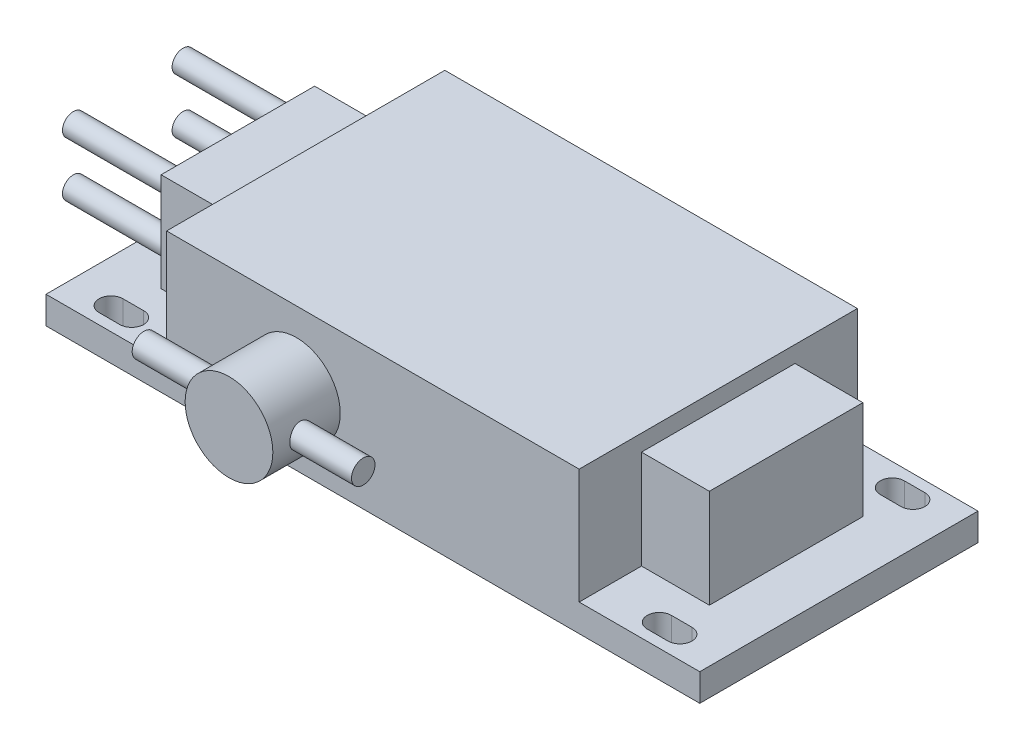
from build123d import *

# Parameters (mm, degrees)
SKETCH1_W           = 119.25
SKETCH1_H           = 50.75
EXTRUDE1_DEPTH      = 5
SKETCH2_W           = 75.25
SKETCH2_H           = 50.75
EXTRUDE2_DEPTH      = 21
SKETCH3_W           = 100
SKETCH3_H           = 28
EXTRUDE3_DEPTH      = 18
SKETCH4_R           = 8
EXTRUDE4_DEPTH      = 12.3
EXTRUDE5_DEPTH      = 20
EXTRUDE5_DEPTH_BACK = 20
EXTRUDE5_START      = -52.32
SKETCH5_R           = 2.144071556
SKETCH6_R           = 2
EXTRUDE6_DEPTH      = 20


with BuildPart() as part:
    # Sketch1 → Extrude1 (new body)
    with BuildSketch(Plane(origin=(0, 0, 0), x_dir=(1, 0, 0), z_dir=(0, 1, 0))):
        with Locations((59.625, 0)):
            Rectangle(SKETCH1_W, SKETCH1_H)
        with BuildLine():
            Line((107.74, 23.435), (111.51, 23.435))
            ThreePointArc((111.51, 23.435), (113.695, 21.25), (111.51, 19.065))
            Line((111.51, 19.065), (107.74, 19.065))
            ThreePointArc((107.74, 19.065), (105.555, 21.25), (107.74, 23.435))
        make_face(mode=Mode.SUBTRACT)
        with BuildLine():
            Line((107.74, -19.065), (111.51, -19.065))
            ThreePointArc((111.51, -19.065), (113.695, -21.25), (111.51, -23.435))
            Line((111.51, -23.435), (107.74, -23.435))
            ThreePointArc((107.74, -23.435), (105.555, -21.25), (107.74, -19.065))
        make_face(mode=Mode.SUBTRACT)
        with BuildLine():
            Line((7.74, -19.065), (11.51, -19.065))
            ThreePointArc((11.51, -19.065), (13.695, -21.25), (11.51, -23.435))
            Line((11.51, -23.435), (7.74, -23.435))
            ThreePointArc((7.74, -23.435), (5.555, -21.25), (7.74, -19.065))
        make_face(mode=Mode.SUBTRACT)
        with BuildLine():
            Line((7.74, 23.435), (11.51, 23.435))
            ThreePointArc((11.51, 23.435), (13.695, 21.25), (11.51, 19.065))
            Line((11.51, 19.065), (7.74, 19.065))
            ThreePointArc((7.74, 19.065), (5.555, 21.25), (7.74, 23.435))
        make_face(mode=Mode.SUBTRACT)
    extrude(amount=EXTRUDE1_DEPTH)

    # Sketch2 → Extrude2 (add)
    with BuildSketch(Plane(origin=(0, 5, 0), x_dir=(1, 0, 0), z_dir=(0, 1, 0))):
        with Locations((59.625, 0)):
            Rectangle(SKETCH2_W, SKETCH2_H)
    extrude(amount=EXTRUDE2_DEPTH)

    # Sketch3 → Extrude3 (add)
    with BuildSketch(Plane(origin=(0, 5, 0), x_dir=(1, 0, 0), z_dir=(0, 1, 0))):
        with Locations((59.625, 0)):
            Rectangle(SKETCH3_W, SKETCH3_H)
    extrude(amount=EXTRUDE3_DEPTH)

    # Sketch4 → Extrude4 (add)
    with BuildSketch(Plane.XY.offset(25.375)):
        with Locations((45.677401857, 13)):
            Circle(SKETCH4_R)
    extrude(amount=EXTRUDE4_DEPTH)

    # Sketch5 → Extrude5 (add, two sides: drawn at the far end of the back side and taken through both)
    with BuildSketch(Plane(origin=(97.25, 0, 0), x_dir=(0, 0, -1), z_dir=(1, 0, 0)).offset(EXTRUDE5_START - EXTRUDE5_DEPTH_BACK)):
        with Locations((-32.438828155, 13)):
            Circle(SKETCH5_R)
    extrude(amount=EXTRUDE5_DEPTH + EXTRUDE5_DEPTH_BACK)

    # Sketch6 → Extrude6 (add)
    with BuildSketch(Plane.ZY.offset(-9.625)):
        with Locations((-10, 9)):
            Circle(SKETCH6_R)
        with Locations((-10, 19)):
            Circle(SKETCH6_R)
        with Locations((10, 9)):
            Circle(SKETCH6_R)
        with Locations((10, 19)):
            Circle(SKETCH6_R)
    extrude(amount=EXTRUDE6_DEPTH)


solid = part.part
